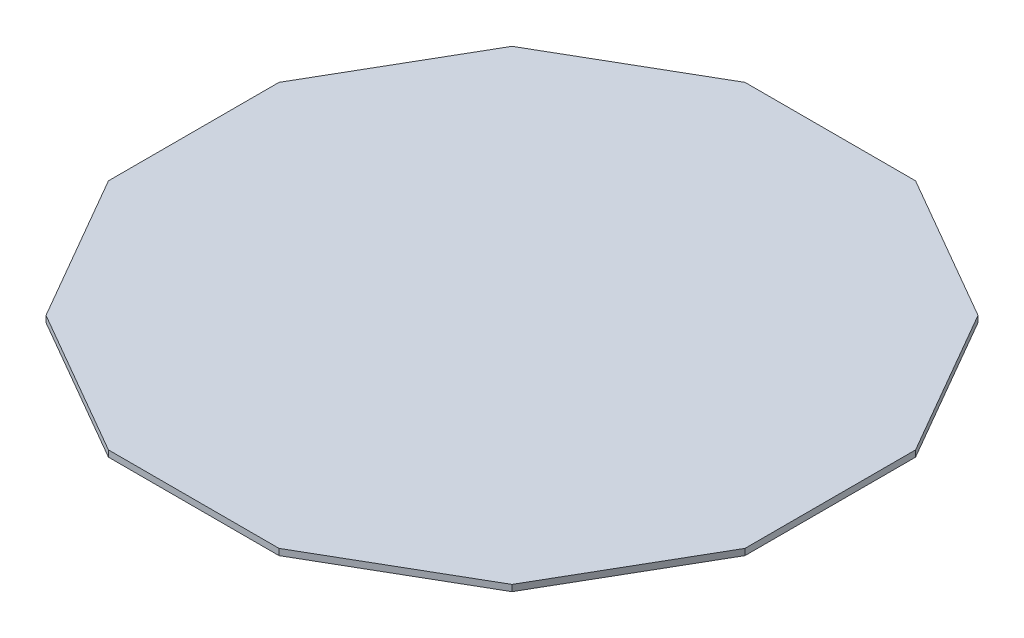
from build123d import *

# Parameters (mm, degrees)
BOSS_EXTRUDE1_DEPTH = 2.921


with BuildPart() as part:
    # Sketch1 → Boss-Extrude1 (new body)
    with BuildSketch(Plane(origin=(0, 0, 0), x_dir=(1, 0, 0), z_dir=(0, 1, 0))):
        Polygon((107.763073453, 107.763073453), (39.444022474, 147.207095926), (-39.444022474, 147.207095926), (-107.763073453, 107.763073453), (-147.207095926, 39.444022474), (-147.207095926, -39.444022474), (-107.763073453, -107.763073453), (-39.444022474, -147.207095926), (39.444022474, -147.207095926), (107.763073453, -107.763073453), (147.207095926, -39.444022474), (147.207095926, 39.444022474), align=None)
    extrude(amount=-BOSS_EXTRUDE1_DEPTH)


solid = part.part
